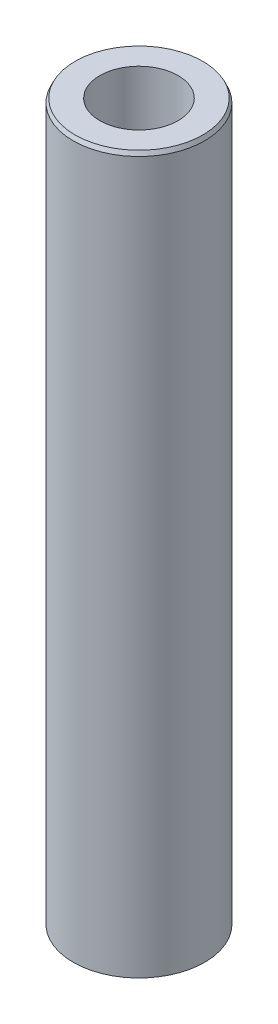
from build123d import *
from OCP.BRepFilletAPI import BRepFilletAPI_MakeChamfer

# Parameters (mm, degrees)
SKETCH1_R           = 55
BOSS_EXTRUDE1_DEPTH = 600
SKETCH2_R           = 32.720314025
CUT_EXTRUDE1_DEPTH  = 606.020660804
CHAMFER1_SIZE       = 3.416693238
CHAMFER1_SIZE2      = 1.606268155


with BuildPart() as part:
    # Sketch1 → Boss-Extrude1 (new body)
    with BuildSketch(Plane(origin=(0, 0, 0), x_dir=(1, 0, 0), z_dir=(0, 1, 0))):
        Circle(SKETCH1_R)
    extrude(amount=BOSS_EXTRUDE1_DEPTH)

    # Sketch2 → Cut-Extrude1 (cut, through all)
    with BuildSketch(Plane(origin=(0, 0, 0), x_dir=(1, 0, 0), z_dir=(0, 1, 0))):
        Circle(SKETCH2_R)
    extrude(amount=CUT_EXTRUDE1_DEPTH, mode=Mode.SUBTRACT)

    # Chamfer1: one chamfer whose edges measure the first distance from different faces: ONE call of the kernel's chamfer builder (chamfer() names one face for all edges)
    chamfer1_edges_1 = [part.edges().sort_by_distance(p)[0] for p in [
        (-55, 600, 0),
    ]]
    chamfer1_side_1 = [part.faces().sort_by_distance(p)[0] for p in [
        (-55, 300, 0),
    ]]
    chamfer1_edges_2 = [part.edges().sort_by_distance(p)[0] for p in [
        (-55, 0, 0),
    ]]
    chamfer1_side_2 = [part.faces().sort_by_distance(p)[0] for p in [
        (-53.444365081, 0, 0),
    ]]
    chamfer1 = BRepFilletAPI_MakeChamfer(part.part.solid().wrapped)
    for e in chamfer1_edges_1:
        chamfer1.Add(CHAMFER1_SIZE, CHAMFER1_SIZE2, e.wrapped, chamfer1_side_1[0].wrapped)  # the first distance lies on this face
    for e in chamfer1_edges_2:
        chamfer1.Add(CHAMFER1_SIZE, CHAMFER1_SIZE2, e.wrapped, chamfer1_side_2[0].wrapped)  # the first distance lies on this face
    add(Compound.cast(chamfer1.Shape()), mode=Mode.REPLACE)


solid = part.part
